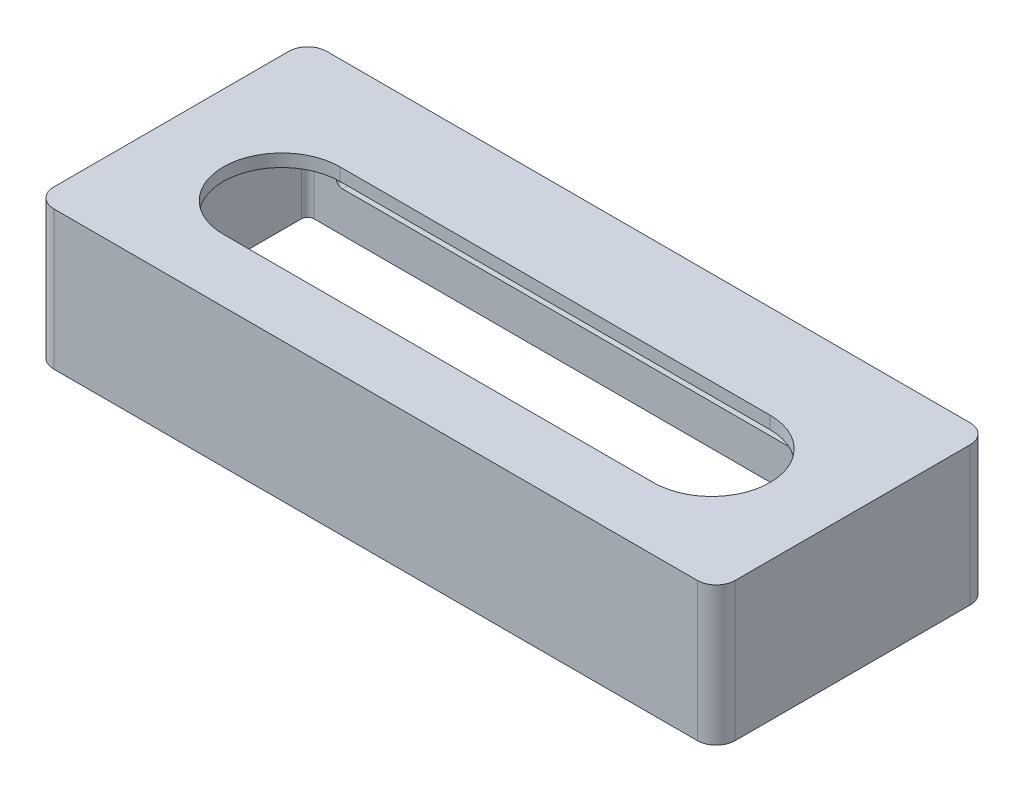
from build123d import *

# Parameters (mm, degrees)
BOSS_EXTRUDE2_DEPTH = 22
SHELL1_START        = -22
SHELL1_DEPTH        = 20
SKETCH2_W           = 99.356893422
SKETCH2_H           = 33.700277524
CUT_EXTRUDE1_DEPTH  = 20
SKETCH3_W           = 10.526500884
SKETCH3_H           = 10.645693642
CUT_EXTRUDE2_DEPTH  = 2
CUT_EXTRUDE3_DEPTH  = 2


# Read off the part's stored shape, not the designer's step: Shell1
with BuildPart() as part:
    # Sketch1 → Boss-Extrude2 (new body)
    with BuildSketch(Plane(origin=(0, 0, 0), x_dir=(1, 0, 0), z_dir=(0, 1, 0))):
        with BuildLine():
            Line((-51, 24.05), (51, 24.05))
            ThreePointArc((51, 24.05), (53.121320344, 23.171320344), (54, 21.05))
            Line((54, 21.05), (54, -16.2))
            ThreePointArc((54, -16.2), (53.121320344, -18.321320344), (51, -19.2))
            Line((51, -19.2), (-51, -19.2))
            ThreePointArc((-51, -19.2), (-53.121320344, -18.321320344), (-54, -16.2))
            Line((-54, -16.2), (-54, 21.05))
            ThreePointArc((-54, 21.05), (-53.121320344, 23.171320344), (-51, 24.05))
        make_face()
        with BuildLine():
            Line((-34.075, 9.25), (34.075, 9.25))
            ThreePointArc((34.075, 9.25), (43.325, 0), (34.075, -9.25))
            Line((34.075, -9.25), (-34.075, -9.25))
            ThreePointArc((-34.075, -9.25), (-43.325, 0), (-34.075, 9.25))
        make_face(mode=Mode.SUBTRACT)
    extrude(amount=-BOSS_EXTRUDE2_DEPTH)

    # Shell1 outline → Shell1 (cut)
    with BuildSketch(Plane(origin=(0, 0, 0), x_dir=(1, 0, 0), z_dir=(0, 1, 0)).offset(SHELL1_START)):
        with BuildLine():
            Line((-52, 21.05), (-52, -16.2))
            ThreePointArc((-52, -16.2), (-51.707106781, -16.907106781), (-51, -17.2))
            Line((-51, -17.2), (51, -17.2))
            ThreePointArc((51, -17.2), (51.707106781, -16.907106781), (52, -16.2))
            Line((52, -16.2), (52, 21.05))
            ThreePointArc((52, 21.05), (51.707106781, 21.757106781), (51, 22.05))
            Line((51, 22.05), (-51, 22.05))
            ThreePointArc((-51, 22.05), (-51.707106781, 21.757106781), (-52, 21.05))
        make_face()
        with BuildLine():
            ThreePointArc((-34.075, -11.25), (-45.325, 0), (-34.075, 11.25))
            Line((-34.075, 11.25), (34.075, 11.25))
            ThreePointArc((34.075, 11.25), (45.325, 0), (34.075, -11.25))
            Line((34.075, -11.25), (-34.075, -11.25))
        make_face(mode=Mode.SUBTRACT)
    extrude(amount=SHELL1_DEPTH, mode=Mode.SUBTRACT)

    # Sketch2 → Cut-Extrude1 (cut)
    with BuildSketch(Plane.XZ.offset(22)):
        Rectangle(SKETCH2_W, SKETCH2_H)
    extrude(amount=-CUT_EXTRUDE1_DEPTH, mode=Mode.SUBTRACT)

    # Sketch3 → Cut-Extrude2 (cut)
    with BuildSketch(Plane(origin=(0, 0, -24.05), x_dir=(-1, 0, 0), z_dir=(0, 0, -1))):
        with Locations((-43.321442995, -16.677153179)):
            Rectangle(SKETCH3_W, SKETCH3_H)
    extrude(amount=-CUT_EXTRUDE2_DEPTH, mode=Mode.SUBTRACT)

    # Sketch6 → Cut-Extrude3 (cut)
    with BuildSketch(Plane(origin=(0, 0, -24.05), x_dir=(-1, 0, 0), z_dir=(0, 0, -1))):
        with BuildLine():
            Line((46.497989358, -4.136848822), (-46.502010642, -4.136848822))
            ThreePointArc((-46.502010642, -4.136848822), (-47.502010642, -3.136848822), (-46.502010642, -2.136848822))
            Line((-46.502010642, -2.136848822), (46.497989358, -2.136848822))
            ThreePointArc((46.497989358, -2.136848822), (47.497989358, -3.136848822), (46.497989358, -4.136848822))
        make_face()
        with BuildLine():
            Line((46.497989358, -8.136848822), (-46.502010642, -8.136848822))
            ThreePointArc((-46.502010642, -8.136848822), (-47.502010642, -7.136848822), (-46.502010642, -6.136848822))
            Line((-46.502010642, -6.136848822), (46.497989358, -6.136848822))
            ThreePointArc((46.497989358, -6.136848822), (47.497989358, -7.136848822), (46.497989358, -8.136848822))
        make_face()
        with BuildLine():
            Line((-32.921100396, -9.626506099), (46.497989358, -9.626506099))
            ThreePointArc((46.497989358, -9.626506099), (47.497989358, -10.626506099), (46.497989358, -11.626506099))
            Line((46.497989358, -11.626506099), (-32.921100396, -11.626506099))
            ThreePointArc((-32.921100396, -11.626506099), (-33.921100396, -10.626506099), (-32.921100396, -9.626506099))
        make_face()
        with BuildLine():
            Line((-32.921100396, -13.626506099), (46.497989358, -13.626506099))
            ThreePointArc((46.497989358, -13.626506099), (47.497989358, -14.626506099), (46.497989358, -15.626506099))
            Line((46.497989358, -15.626506099), (-32.921100396, -15.626506099))
            ThreePointArc((-32.921100396, -15.626506099), (-33.921100396, -14.626506099), (-32.921100396, -13.626506099))
        make_face()
    extrude(amount=-CUT_EXTRUDE3_DEPTH, mode=Mode.SUBTRACT)


solid = part.part
